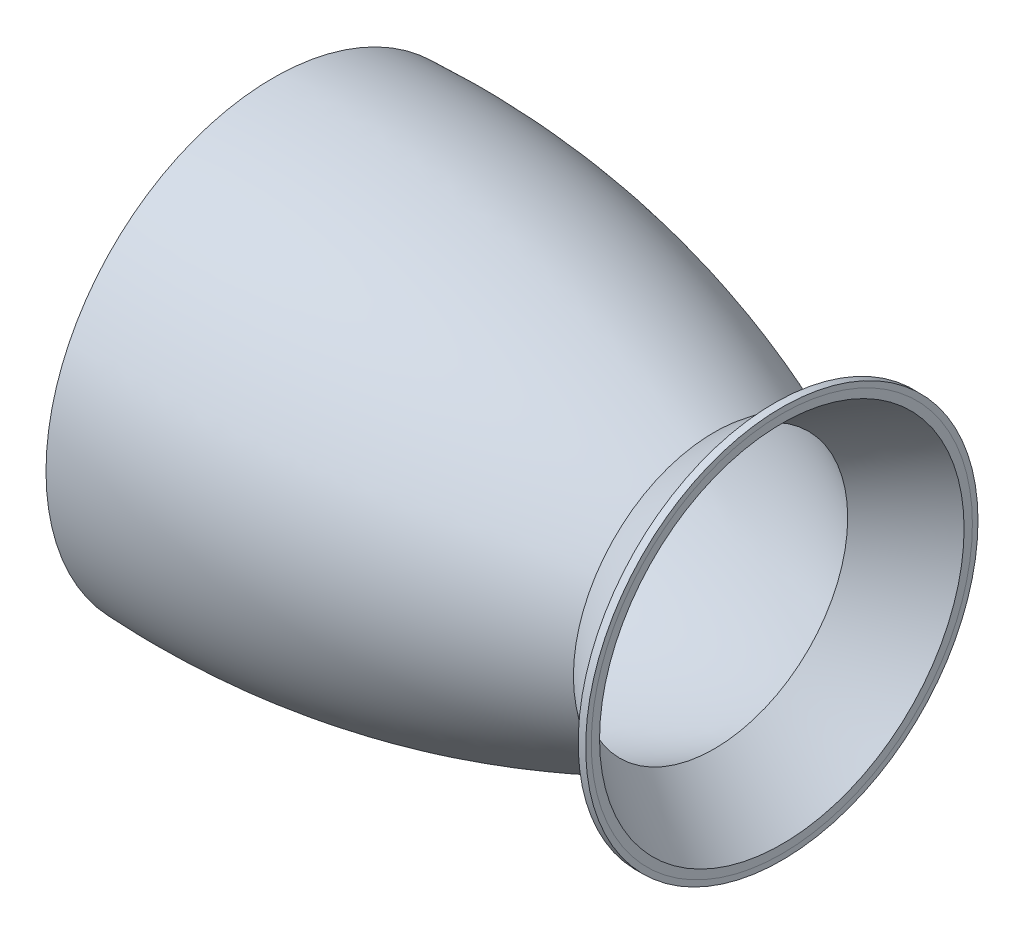
from build123d import *

# Parameters (mm, degrees)
CUT_EXTRUDE1_DEPTH      = 9173.27595609
CUT_EXTRUDE1_DEPTH_BACK = 9173.27595609
SKETCH3_W               = 6368.981626367
SKETCH3_H               = 6269.498595836
SKETCH5_R               = 1334.443216265
SKETCH5_R_2             = 1296.343216265
BOSS_EXTRUDE1_DEPTH     = 50.8


with BuildPart() as part:
    # Sketch1 → Revolve1 (revolve)
    with BuildSketch(Plane.XY):
        with BuildLine():
            Line((8000, 3487.09456907), (8000, 3614.097906364))
            add(Edge.make_bspline(
                [(3000, 1915.575812728), (5212.252369751, 3657.036228718), (8000, 3614.097906364)],
                knots=[0, 0, 0, 1, 1, 1], degree=2))
            add(Edge.make_bspline(
                [(0, 2503.157086019), (1544.377938523, 2575.865848039), (3000, 1915.575812728)],
                knots=[0, 0, 0, 1, 1, 1], degree=2))
            Line((0, 2503.157086019), (0, 2429.300878983))
            add(Edge.make_bspline(
                [(3000, 1865.907177112), (1598.686922202, 2548.195119625), (0, 2429.300878983)],
                knots=[0, 0, 0, 1, 1, 1], degree=2))
            add(Edge.make_bspline(
                [(3000, 1865.907177112), (5254.226078548, 3603.176495063), (8000, 3487.09456907)],
                knots=[0, 0, 0, 1, 1, 1], degree=2))
        make_face()
    revolve(axis=Axis((-55.817920771, 957.787906364, 0), (1, 0, 0)))

    # Sketch3 → Cut-Extrude1 (cut, two sides: drawn at the far end of the back side and taken through both)
    with BuildSketch(Plane(origin=(0, 0, 0), x_dir=(1, 0, 0), z_dir=(0, 1, 0)).offset(-CUT_EXTRUDE1_DEPTH_BACK)):
        with Locations((6644.490813183, 0)):
            Rectangle(SKETCH3_W, SKETCH3_H)
    extrude(amount=CUT_EXTRUDE1_DEPTH + CUT_EXTRUDE1_DEPTH_BACK, mode=Mode.SUBTRACT)


with BuildPart() as body_2:
    # Sketch5 → Boss-Extrude1 (new body)
    with BuildSketch(Plane(origin=(3460, 0, 0), x_dir=(0, 0, -1), z_dir=(1, 0, 0))):
        with Locations((0, 957.787906364)):
            Circle(SKETCH5_R)
        with Locations((0, 957.787906364)):
            Circle(SKETCH5_R_2, mode=Mode.SUBTRACT)
    extrude(amount=-BOSS_EXTRUDE1_DEPTH)


solid = Compound([part.part, body_2.part])
